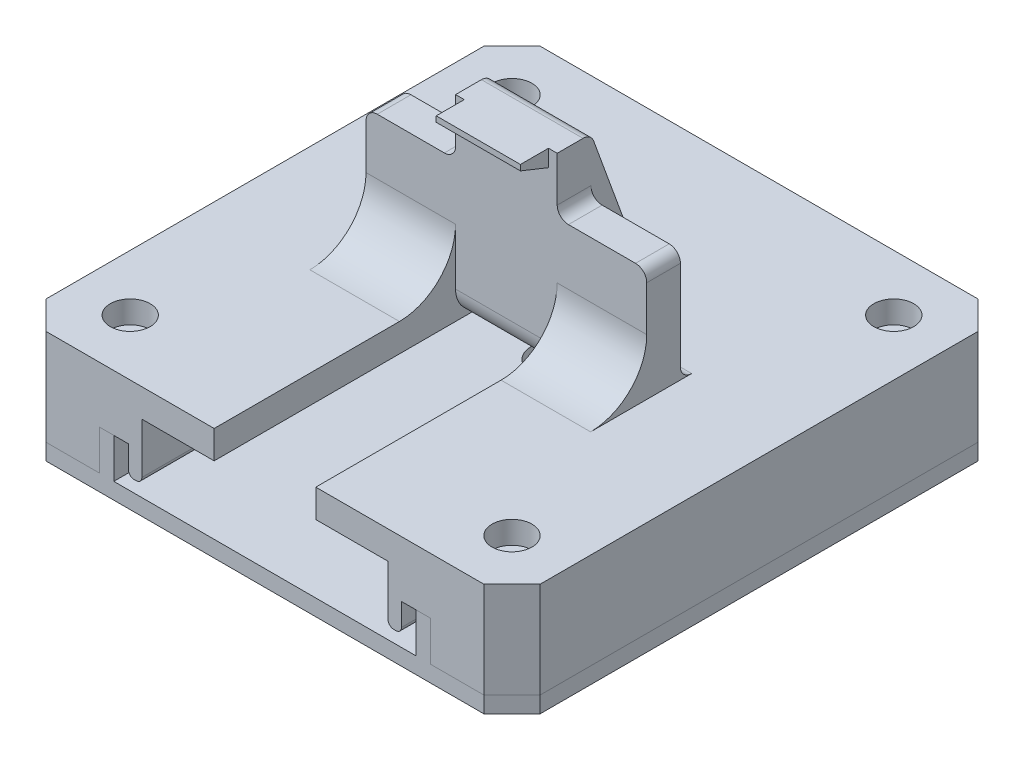
from build123d import *

# Parameters (mm, degrees)
SCHIZZO2_W                      = 88
SCHIZZO2_H                      = 88
ESTRUSIONE_ESTRUSIONE1_DEPTH    = 20
CUT_EXTRUDE1_DEPTH              = 101.399203184
CUT_EXTRUDE2_REACH              = 67.361
SKETCH2_W                       = 18.1
SKETCH2_H                       = 74
CUT_EXTRUDE3_REACH              = 66.532
SKETCH3_R                       = 4.05
CUT_EXTRUDE3_DIRECTION_2_DEPTH  = 15
CUT_EXTRUDE4_DEPTH              = 15
CUT_EXTRUDE4_DEPTH_BACK         = 3
SKETCH9_R                       = 4.05
SKETCH4_W                       = 50
SKETCH4_H                       = 6
BOSS_EXTRUDE1_DEPTH             = 20
SKETCH5_W                       = 18.1
SKETCH5_H                       = 6
BOSS_EXTRUDE2_DEPTH             = 10
FILLET1_R                       = 10
F_4_0_4_DIAMETER_HOLE1_D        = 4
SKETCH12_R                      = 3.55
CUT_EXTRUDE5_DEPTH              = 4
SMUSSO1_SIZE                    = 5
RACCORDO2_R                     = 2
FILLET2_R                       = 1
BOSS_EXTRUDE3_REACH             = 81.825
BOSS_EXTRUDE3_DIRECTION_2_REACH = 81.825
FILLET3_R                       = 5
FILLET4_R                       = 2
SKETCH14_W                      = 15
SKETCH14_H                      = 3
BOSS_EXTRUDE4_DEPTH             = 5
CHAMFER1_SIZE2                  = 2
CHAMFER1_SIZE                   = 5
SPLIT1_SURFACE_1_BACK           = 135.119
SPLIT1_SURFACE_1_DEPTH          = 270.238
SPLIT1_SURFACE_2_BACK           = 135.119
SPLIT1_SURFACE_2_DEPTH          = 270.238


with BuildPart() as part:
    # Schizzo2 → Estrusione-Estrusione1 (new body)
    with BuildSketch(Plane(origin=(0, 0, 0), x_dir=(1, 0, 0), z_dir=(0, 1, 0))):
        Rectangle(SCHIZZO2_W, SCHIZZO2_H)
    extrude(amount=ESTRUSIONE_ESTRUSIONE1_DEPTH)

    # Sketch1 → Cut-Extrude1 (cut, through all)
    with BuildSketch(Plane.XY.offset(44)):
        Polygon((-26.925, 2.9), (26.925, 2.9), (26.925, 10), (24.325, 10), (24.325, 5), (21.925, 5), (21.925, 15), (-21.925, 15), (-21.925, 5), (-24.325, 5), (-24.325, 10), (-26.925, 10), align=None)
    extrude(amount=-CUT_EXTRUDE1_DEPTH, mode=Mode.SUBTRACT)

    # Sketch2 → Cut-Extrude2 (cut, up to next)
    with BuildSketch(Plane(origin=(0, 20, 0), x_dir=(1, 0, 0), z_dir=(0, 1, 0)), mode=Mode.PRIVATE) as cut_extrude2_sk1:
        with Locations((0, -38)):
            Rectangle(SKETCH2_W, SKETCH2_H)
    cut_extrude2_tool1 = extrude(cut_extrude2_sk1.sketch, amount=-CUT_EXTRUDE2_REACH, mode=Mode.PRIVATE) & part.part
    add(cut_extrude2_tool1.solids().sort_by_distance((0, 20, 38))[0], mode=Mode.SUBTRACT)

    # Sketch3 → Cut-Extrude3 (cut, up to next)
    with BuildSketch(Plane(origin=(0, 2.9, 0), x_dir=(1, 0, 0), z_dir=(0, 1, 0)), mode=Mode.PRIVATE) as cut_extrude3_sk1:
        with Locations(Location((-6.5, 14, 0), (0, 0, 270))):
            Circle(SKETCH3_R)
    cut_extrude3_tool1 = extrude(cut_extrude3_sk1.sketch, amount=-CUT_EXTRUDE3_REACH, mode=Mode.PRIVATE) & part.part
    add(cut_extrude3_tool1.solids().sort_by_distance((-6.5, 2.9, -14))[0], mode=Mode.SUBTRACT)

    # Sketch3 → Cut-Extrude3 direction 2 (cut)
    with BuildSketch(Plane(origin=(0, 2.9, 0), x_dir=(1, 0, 0), z_dir=(0, 1, 0))):
        with Locations(Location((-6.5, 14, 0), (0, 0, 270))):
            Circle(SKETCH3_R)
    extrude(amount=CUT_EXTRUDE3_DIRECTION_2_DEPTH, mode=Mode.SUBTRACT)

    # Sketch9 → Cut-Extrude4 (cut, two sides: drawn at the far end of the back side and taken through both)
    with BuildSketch(Plane(origin=(0, 2.9, 0), x_dir=(1, 0, 0), z_dir=(0, 1, 0)).offset(-CUT_EXTRUDE4_DEPTH_BACK)):
        with Locations(Location((6.5, 14, 0), (0, 0, 270))):
            Circle(SKETCH9_R)
    extrude(amount=CUT_EXTRUDE4_DEPTH + CUT_EXTRUDE4_DEPTH_BACK, mode=Mode.SUBTRACT)

    # Sketch4 → Boss-Extrude1 (add)
    with BuildSketch(Plane(origin=(0, 20, 0), x_dir=(1, 0, 0), z_dir=(0, 1, 0))):
        with Locations((0, 2)):
            Rectangle(SKETCH4_W, SKETCH4_H)
    extrude(amount=BOSS_EXTRUDE1_DEPTH)

    # Sketch5 → Boss-Extrude2 (add)
    with BuildSketch(Plane(origin=(0, 40, 0), x_dir=(1, 0, 0), z_dir=(0, 1, 0))):
        with Locations((0, 2)):
            Rectangle(SKETCH5_W, SKETCH5_H)
    extrude(amount=BOSS_EXTRUDE2_DEPTH)

    # Fillet1
    fillet1_edges = [part.edges().sort_by_distance(p)[0] for p in [
        (17.025, 20, 1),
        (-17.025, 20, 1),
    ]]
    fillet(fillet1_edges, radius=FILLET1_R)

    # Ø4.0 (4) Diameter Hole1 (through all)
    with Locations(Plane(origin=(0, 20, 0), x_dir=(-1, 0, 0), z_dir=(0, 1, 0))):
        with Locations((-34, -34), (-34, 34), (34, 34), (34, -34)):
            Hole(F_4_0_4_DIAMETER_HOLE1_D / 2)

    # Sketch12 → Cut-Extrude5 (cut)
    with BuildSketch(Plane(origin=(0, 20, 0), x_dir=(1, 0, 0), z_dir=(0, 1, 0))):
        with Locations(Location((34, 34, 0), (0, 0, 270))):
            Circle(SKETCH12_R)
        with Locations(Location((-34, 34, 0), (0, 0, 90))):
            Circle(SKETCH12_R)
        with Locations(Location((-34, -34, 0), (0, 0, 270))):
            Circle(SKETCH12_R)
        with Locations(Location((34, -34, 0), (0, 0, 90))):
            Circle(SKETCH12_R)
    extrude(amount=-CUT_EXTRUDE5_DEPTH, mode=Mode.SUBTRACT)

    # Smusso1
    smusso1_edges = [part.edges().sort_by_distance(p)[0] for p in [
        (44, 10, 44),
        (-44, 10, 44),
        (-44, 10, -44),
        (44, 10, -44),
    ]]
    chamfer(smusso1_edges, length=SMUSSO1_SIZE)

    # Raccordo2
    raccordo2_edges = [part.edges().sort_by_distance(p)[0] for p in [
        (-9.05, 40, -2),
        (9.05, 40, -2),
        (0, 20, -5),
        (-25, 40, -2),
        (25, 40, -2),
    ]]
    fillet(raccordo2_edges, radius=RACCORDO2_R)

    # Fillet2
    fillet2_edges = [part.edges().sort_by_distance(p)[0] for p in [
        (-24.325, 5, 0),
        (-21.925, 5, 0),
        (21.925, 5, 0),
        (24.325, 5, 0),
    ]]
    fillet(fillet2_edges, radius=FILLET2_R)

    # Boss-Extrude3: up to this face of the body (flat: up to its plane)
    boss_extrude3_end = Plane(part.part.faces().sort_by_distance((9.05, 46, -2))[0])
    # Sketch13 → Boss-Extrude3 (add, up to the picked face)
    with BuildSketch(Plane(origin=(0, 0, 0), x_dir=(0, 0, -1), z_dir=(1, 0, 0)), mode=Mode.PRIVATE) as boss_extrude3_sk1:
        Polygon((5, 50), (15.919107028, 20), (5, 20), align=None)
    boss_extrude3_tool1 = split(extrude(boss_extrude3_sk1.sketch, amount=BOSS_EXTRUDE3_REACH, mode=Mode.PRIVATE), bisect_by=boss_extrude3_end, keep=Keep.BOTH, mode=Mode.PRIVATE)
    add(boss_extrude3_tool1.solids().sort_by(Axis((0, 30, -8.639702), (1, 0, 0)))[0])

    # Boss-Extrude3 direction 2: up to this face of the body (flat: up to its plane)
    boss_extrude3_direction_2_end = Plane(part.part.faces().sort_by_distance((-9.05, 46, -2))[0])
    # Sketch13 → Boss-Extrude3 direction 2 (add, up to the picked face)
    with BuildSketch(Plane(origin=(0, 0, 0), x_dir=(0, 0, -1), z_dir=(1, 0, 0)), mode=Mode.PRIVATE) as boss_extrude3_direction_2_sk1:
        Polygon((5, 50), (15.919107028, 20), (5, 20), align=None)
    boss_extrude3_direction_2_tool1 = split(extrude(boss_extrude3_direction_2_sk1.sketch, amount=-BOSS_EXTRUDE3_DIRECTION_2_REACH, mode=Mode.PRIVATE), bisect_by=boss_extrude3_direction_2_end, keep=Keep.BOTH, mode=Mode.PRIVATE)
    add(boss_extrude3_direction_2_tool1.solids().sort_by(Axis((0, 30, -8.639702), (-1, 0, 0)))[0])

    # Fillet3
    fillet3_edges = [part.edges().sort_by_distance(p)[0] for p in [
        (0, 15, 1),
    ]]
    fillet(fillet3_edges, radius=FILLET3_R)

    # Fillet4
    fillet4_edges = [part.edges().sort_by_distance(p)[0] for p in [
        (0, 50, -5),
    ]]
    fillet(fillet4_edges, radius=FILLET4_R)

    # Sketch14 → Boss-Extrude4 (add)
    with BuildSketch(Plane.XY.offset(1)):
        with Locations((0, 48.5)):
            Rectangle(SKETCH14_W, SKETCH14_H)
    extrude(amount=BOSS_EXTRUDE4_DEPTH)

    # Chamfer1
    chamfer1_edges = [part.edges().sort_by_distance(p)[0] for p in [
        (0, 47, 6),
    ]]
    chamfer1_side = [part.faces().sort_by_distance(p)[0] for p in [
        (0, 47, 5.96),
    ]]
    chamfer(chamfer1_edges, length=CHAMFER1_SIZE - 0.0001, length2=CHAMFER1_SIZE2 - 0.0001, reference=chamfer1_side[0])  # a hair under: the kernel refuses the full size


with BuildPart() as body_2:
    # Split1: the piece behind the surface
    add(part.part)
    # Split1 surface: a surface, the sketch's curves swept straight by 270.238 mm
    with BuildLine(Plane.XY.offset(44).offset(-SPLIT1_SURFACE_1_BACK), mode=Mode.PRIVATE) as split1_surface_1_path:
        Line((-44, 2.9), (-29.5, 2.9))
        Line((-29.5, 2.9), (-29.5, 10))
        Line((-29.5, 10), (-24.325, 10))
        Line((-24.325, 10), (-24.325, 5))
        Line((-24.325, 5), (24.325, 5))
        Line((24.325, 5), (24.325, 10))
        Line((24.325, 10), (29.5, 10))
        Line((29.5, 10), (29.5, 2.9))
        Line((29.5, 2.9), (44, 2.9))
    split1_surface_1 = Shell.extrude(split1_surface_1_path.wire(), (0 * SPLIT1_SURFACE_1_DEPTH, 0 * SPLIT1_SURFACE_1_DEPTH, 1 * SPLIT1_SURFACE_1_DEPTH))
    split(bisect_by=split1_surface_1, keep=Keep.BOTTOM)


with BuildPart() as part_1:
    add(part.part)

    # Split1: split by a surface, the side it looks to stays
    # Split1 surface: a surface, the sketch's curves swept straight by 270.238 mm
    with BuildLine(Plane.XY.offset(44).offset(-SPLIT1_SURFACE_2_BACK), mode=Mode.PRIVATE) as split1_surface_2_path:
        Line((-44, 2.9), (-29.5, 2.9))
        Line((-29.5, 2.9), (-29.5, 10))
        Line((-29.5, 10), (-24.325, 10))
        Line((-24.325, 10), (-24.325, 5))
        Line((-24.325, 5), (24.325, 5))
        Line((24.325, 5), (24.325, 10))
        Line((24.325, 10), (29.5, 10))
        Line((29.5, 10), (29.5, 2.9))
        Line((29.5, 2.9), (44, 2.9))
    split1_surface_2 = Shell.extrude(split1_surface_2_path.wire(), (0 * SPLIT1_SURFACE_2_DEPTH, 0 * SPLIT1_SURFACE_2_DEPTH, 1 * SPLIT1_SURFACE_2_DEPTH))
    split(bisect_by=split1_surface_2, keep=Keep.TOP)


solid = Compound([body_2.part, part_1.part])
